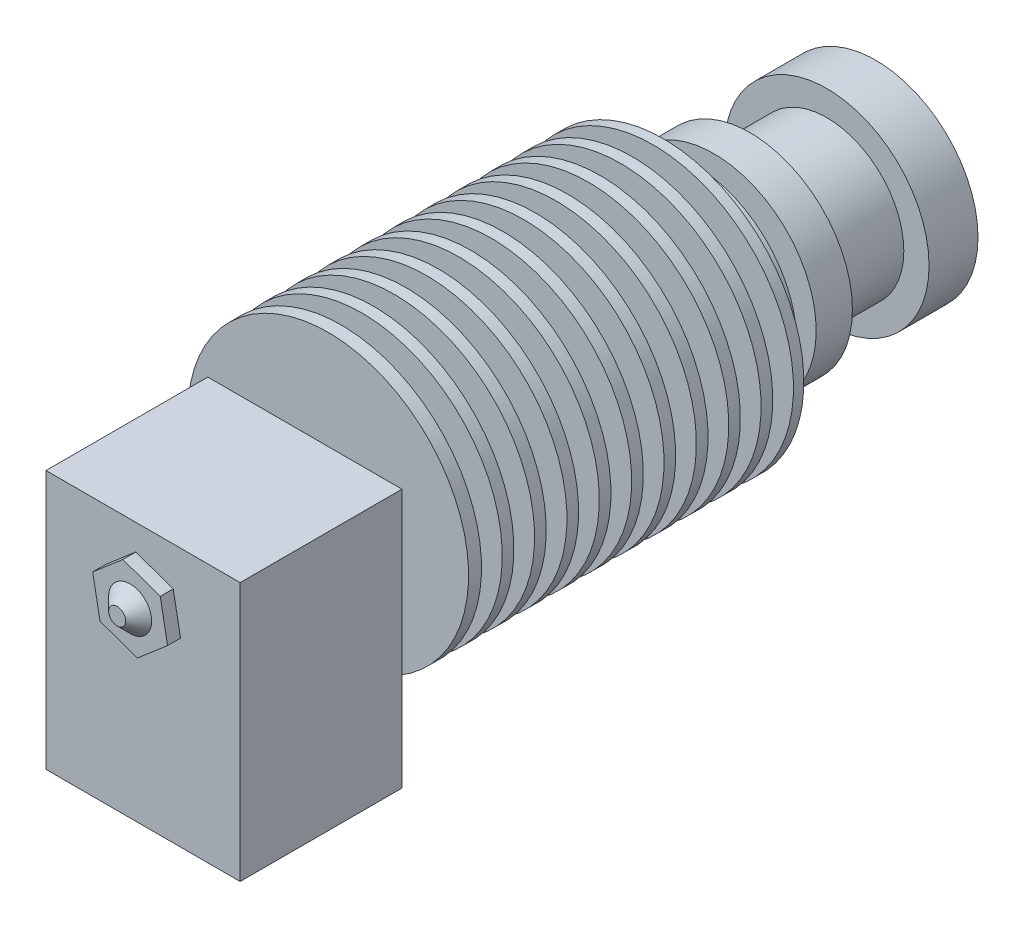
from build123d import *

# Parameters (mm, degrees)
SKETCH1_R           = 10.845
BOSS_EXTRUDE1_DEPTH = 25.9
SKETCH2_W           = 5.345
SKETCH2_H           = 1.6
LPATTERN1_COUNT     = 10
LPATTERN1_PITCH     = 2.5
SKETCH3_R           = 7.9
BOSS_EXTRUDE2_DEPTH = 16.4
SKETCH4_W           = 1.95
SKETCH4_H           = 5.92
SKETCH4_W_2         = 2.9
SKETCH4_H_2         = 1.5
SKETCH5_R           = 2
BOSS_EXTRUDE3_DEPTH = 1.8
SKETCH6_W           = 15
SKETCH6_H           = 20
BOSS_EXTRUDE4_DEPTH = 12.5
BOSS_EXTRUDE5_DEPTH = 1
SKETCH8_R           = 1.65934661
BOSS_EXTRUDE6_DEPTH = 1
BOSS_EXTRUDE6_TAPER = 45


with BuildPart() as part:
    # Sketch1 → Boss-Extrude1 (new body)
    with BuildSketch(Plane.XY):
        Circle(SKETCH1_R)
    extrude(amount=BOSS_EXTRUDE1_DEPTH)

    # Sketch2 → Cut-Revolve1 (revolve, cut)
    with BuildSketch(Plane(origin=(0, 0, 0), x_dir=(1, 0, 0), z_dir=(0, 1, 0))):
        with Locations((-8.1725, -1.6)):
            Rectangle(SKETCH2_W, SKETCH2_H)
    cut_revolve1 = revolve(axis=Axis((0, 0, 0), (0, 0, 1)), mode=Mode.SUBTRACT)

    # LPattern1: Cut-Revolve1 ×10
    with Locations(*[(0, 0, i * LPATTERN1_PITCH) for i in range(1, LPATTERN1_COUNT)]):
        add(cut_revolve1, mode=Mode.SUBTRACT)

    # Sketch3 → Boss-Extrude2 (add)
    with BuildSketch(Plane(origin=(0, 0, 0), x_dir=(-1, 0, 0), z_dir=(0, 0, -1))):
        Circle(SKETCH3_R)
    extrude(amount=BOSS_EXTRUDE2_DEPTH)

    # Sketch4 → Cut-Revolve2 (revolve, cut)
    with BuildSketch(Plane(origin=(0, 0, 0), x_dir=(1, 0, 0), z_dir=(0, 1, 0))):
        with Locations((-6.925, 9.66)):
            Rectangle(SKETCH4_W, SKETCH4_H)
        with Locations((-6.45, 3.15)):
            Rectangle(SKETCH4_W_2, SKETCH4_H_2)
        with Locations((-6.45, 0.75)):
            Rectangle(SKETCH4_W_2, SKETCH4_H_2)
    revolve(axis=Axis((0, 0, 0), (0, 0, -1)), mode=Mode.SUBTRACT)

    # Sketch5 → Boss-Extrude3 (add)
    with BuildSketch(Plane.XY.offset(25.9)):
        Circle(SKETCH5_R)
    extrude(amount=BOSS_EXTRUDE3_DEPTH)

    # Sketch6 → Boss-Extrude4 (add)
    with BuildSketch(Plane.XY.offset(27.7)):
        with Locations((0, -5)):
            Rectangle(SKETCH6_W, SKETCH6_H)
    extrude(amount=BOSS_EXTRUDE4_DEPTH)

    # Sketch7 → Boss-Extrude5 (add)
    with BuildSketch(Plane.XY.offset(40.2)):
        Polygon((2.891396573, -1.018451956), (2.327703553, 1.994796907), (-0.56369302, 3.013248863), (-2.891396573, 1.018451956), (-2.327703553, -1.994796907), (0.56369302, -3.013248863), align=None)
    extrude(amount=BOSS_EXTRUDE5_DEPTH)

    # Sketch8 → Boss-Extrude6 (add)
    with BuildSketch(Plane.XY.offset(41.2)):
        Circle(SKETCH8_R)
    extrude(amount=BOSS_EXTRUDE6_DEPTH, taper=BOSS_EXTRUDE6_TAPER)


solid = part.part
